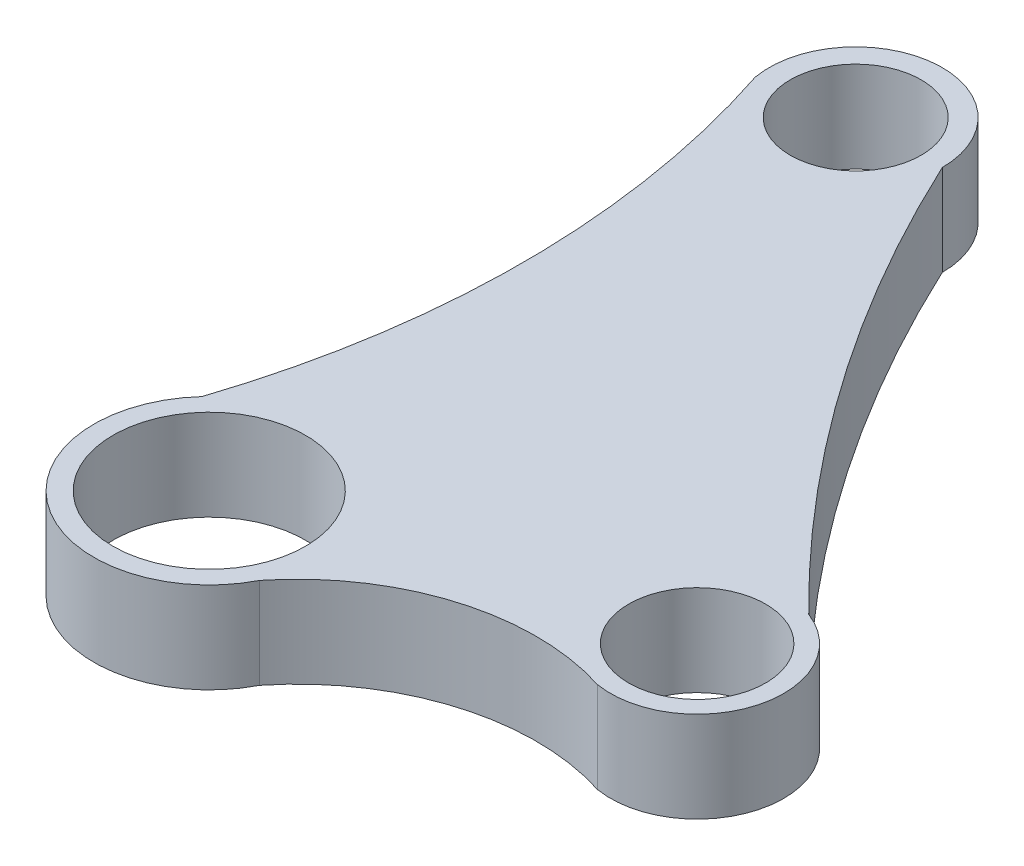
from build123d import *

# Parameters (mm, degrees)
SKETCH1_R           = 10.587882435
SKETCH1_R_2         = 7.199480632
SKETCH1_R_3         = 7.531788478
BOSS_EXTRUDE1_DEPTH = 10


with BuildPart() as part:
    # Sketch1 → Boss-Extrude1 (new body)
    with BuildSketch(Plane(origin=(0, 0, 0), x_dir=(1, 0, 0), z_dir=(0, 1, 0))):
        with BuildLine():
            ThreePointArc((-9.377123624, 8.565019121), (-7.230610711, -10.440702502), (11.315790364, -5.765664614))
            ThreePointArc((11.315790364, -5.765664614), (24.231502384, 2.991591857), (39.835785495, 2.884323653))
            ThreePointArc((39.835785495, 2.884323653), (50.594863387, 9.806139706), (44.760738881, 21.191757204))
            ThreePointArc((44.760738881, 21.191757204), (24.916158819, 44.584427462), (9.525, 71.12))
            ThreePointArc((9.525, 71.12), (-0.839202741, 80.607958883), (-9.377123624, 69.448121553))
            ThreePointArc((-9.377123624, 69.448121553), (-4.481193953, 39.006570337), (-9.377123624, 8.565019121))
        make_face()
        Circle(SKETCH1_R, mode=Mode.SUBTRACT)
        with Locations((0, 71.12)):
            Circle(SKETCH1_R_2, mode=Mode.SUBTRACT)
        with Locations((41.396872631, 12.280526713)):
            Circle(SKETCH1_R_3, mode=Mode.SUBTRACT)
    extrude(amount=BOSS_EXTRUDE1_DEPTH)


solid = part.part
